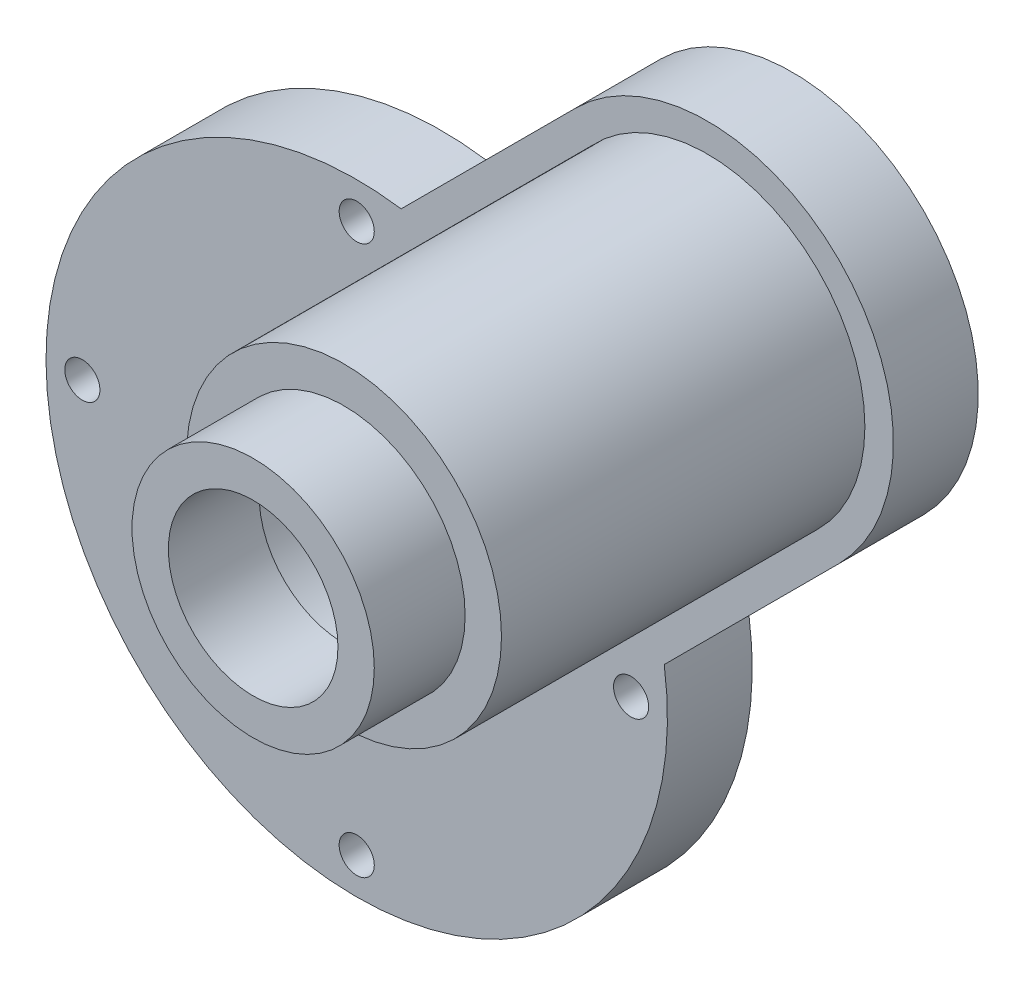
from build123d import *

# Parameters (mm, degrees)
SKETCH1_R           = 9
SKETCH1_R_2         = 1.45
SKETCH1_R_3         = 4
BOSS_EXTRUDE1_DEPTH = 7
SKETCH2_R           = 13
SKETCH2_R_2         = 9
BOSS_EXTRUDE2_DEPTH = 30
SKETCH3_R           = 10
SKETCH3_R_2         = 7
BOSS_EXTRUDE4_DEPTH = 7.5


with BuildPart() as part:
    # Sketch1 → Boss-Extrude1 (new body)
    with BuildSketch(Plane.XY):
        with BuildLine():
            Line((25.386287233, 3.668640143), (39.810111781, 18.09246469))
            ThreePointArc((39.810111781, 18.09246469), (39.810111781, 39.810111781), (18.09246469, 39.810111781))
            Line((18.09246469, 39.810111781), (3.668640143, 25.386287233))
            ThreePointArc((3.668640143, 25.386287233), (-18.137288937, -18.137288937), (25.386287233, 3.668640143))
        make_face()
        with Locations((28.951288236, 28.951288236)):
            Circle(SKETCH1_R, mode=Mode.SUBTRACT)
        with Locations((0, 22.65)):
            Circle(SKETCH1_R_2, mode=Mode.SUBTRACT)
        with Locations((0, -22.65)):
            Circle(SKETCH1_R_2, mode=Mode.SUBTRACT)
        with Locations((-22.65, 0)):
            Circle(SKETCH1_R_2, mode=Mode.SUBTRACT)
        Circle(SKETCH1_R_3, mode=Mode.SUBTRACT)
        with Locations((22.65, 0)):
            Circle(SKETCH1_R_2, mode=Mode.SUBTRACT)
    extrude(amount=BOSS_EXTRUDE1_DEPTH)

    # Sketch2 → Boss-Extrude2 (add)
    with BuildSketch(Plane.XY.offset(7)):
        with Locations((28.951288236, 28.951288236)):
            Circle(SKETCH2_R)
        with Locations((28.951288236, 28.951288236)):
            Circle(SKETCH2_R_2, mode=Mode.SUBTRACT)
    extrude(amount=BOSS_EXTRUDE2_DEPTH)

    # Sketch3 → Boss-Extrude4 (add)
    with BuildSketch(Plane.XY.offset(37)):
        with Locations((28.951288236, 28.951288236)):
            Circle(SKETCH3_R)
        with Locations((28.951288236, 28.951288236)):
            Circle(SKETCH3_R_2, mode=Mode.SUBTRACT)
    extrude(amount=BOSS_EXTRUDE4_DEPTH)


solid = part.part
